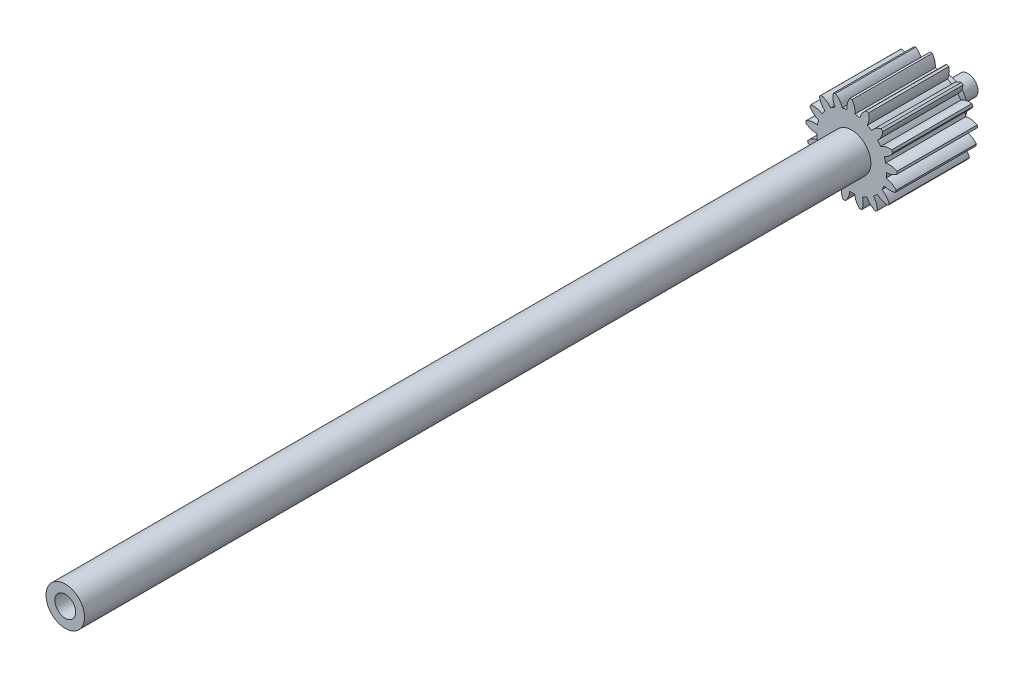
from build123d import *

# Parameters (mm, degrees)
SKETCH1_R           = 2.4
BOSS_EXTRUDE1_DEPTH = 110
SKETCH6_R           = 1.25
BOSS_EXTRUDE2_DEPTH = 2.5
SKETCH7_R           = 1.3
CUT_EXTRUDE1_DEPTH  = 2.5
JOIN1_START         = 2
JOIN1_OUTLINE_R     = 2.4
JOIN1_DEPTH         = 10


# Read off the part's stored shape, not the designer's step: Join1
with BuildPart() as part:
    # Sketch1 → Boss-Extrude1 (new body)
    with BuildSketch(Plane.XY):
        Circle(SKETCH1_R)
    extrude(amount=BOSS_EXTRUDE1_DEPTH)

    # Sketch6 → Boss-Extrude2 (add)
    with BuildSketch(Plane(origin=(0, 0, 0), x_dir=(-1, 0, 0), z_dir=(0, 0, -1))):
        Circle(SKETCH6_R)
    extrude(amount=BOSS_EXTRUDE2_DEPTH)

    # Sketch7 → Cut-Extrude1 (cut)
    with BuildSketch(Plane.XY.offset(110)):
        Circle(SKETCH7_R)
    extrude(amount=-CUT_EXTRUDE1_DEPTH, mode=Mode.SUBTRACT)

    # Join1 outline → Join1 (add)
    with BuildSketch(Plane.XY.offset(JOIN1_START)):
        with BuildLine():
            ThreePointArc((-3.708118179, -2.272368933), (-4.244159788, -2.755671749), (-4.578357083, -3.395386049))
            ThreePointArc((-4.578357083, -3.395386049), (-4.491909089, -3.508953224), (-4.402644734, -3.620320337))
            ThreePointArc((-4.402644734, -3.620320337), (-3.701059107, -3.450910109), (-3.102375311, -3.047797308))
            ThreePointArc((-3.102375311, -3.047797308), (-2.876945397, -3.261439281), (-2.636842886, -3.458447715))
            ThreePointArc((-2.636842886, -3.458447715), (-2.962097686, -4.102754733), (-3.042635922, -4.81999654))
            ThreePointArc((-3.042635922, -4.81999654), (-2.921000374, -4.89466616), (-2.7975334, -4.966266895))
            ThreePointArc((-2.7975334, -4.966266895), (-2.204522319, -4.554854601), (-1.791887445, -3.962693577))
            ThreePointArc((-1.791887445, -3.962693577), (-1.504503928, -4.080474106), (-1.20944735, -4.177443968))
            ThreePointArc((-1.20944735, -4.177443968), (-1.279987877, -4.895737955), (-1.095989921, -5.593639789))
            ThreePointArc((-1.095989921, -5.593639789), (-0.955594371, -5.619327308), (-0.814599678, -5.64149159))
            ThreePointArc((-0.814599678, -5.64149159), (-0.410252576, -5.04364074), (-0.239395251, -4.34240612))
            ThreePointArc((-0.239395251, -4.34240612), (0.071129132, -4.348418292), (0.381290753, -4.332253266))
            ThreePointArc((0.381290753, -4.332253266), (0.574991387, -5.027524639), (0.998675593, -5.61183099))
            ThreePointArc((0.998675593, -5.61183099), (1.138869946, -5.585067166), (1.278350244, -5.554801585))
            ThreePointArc((1.278350244, -5.554801585), (1.439424051, -4.851255249), (1.345428599, -4.135652655))
            ThreePointArc((1.345428599, -4.135652655), (1.63715581, -4.029084493), (1.920533427, -3.901967754))
            ThreePointArc((1.920533427, -3.901967754), (2.352314878, -4.480316262), (2.958464434, -4.872113319))
            ThreePointArc((2.958464434, -4.872113319), (3.079523566, -4.796512755), (3.198651882, -4.717904846))
            ThreePointArc((3.198651882, -4.717904846), (3.094698483, -4.003680856), (2.748544861, -3.370356383))
            ThreePointArc((2.748544861, -3.370356383), (2.982075524, -3.165600507), (3.200397419, -2.944699876))
            ThreePointArc((3.200397419, -2.944699876), (3.81194521, -3.328016348), (4.518696259, -3.474389747))
            ThreePointArc((4.518696259, -3.474389747), (4.604270465, -3.360162718), (4.686957859, -3.243828915))
            ThreePointArc((4.686957859, -3.243828915), (4.332016737, -2.615387177), (3.78045491, -2.149874805))
            ThreePointArc((3.78045491, -2.149874805), (3.924249414, -1.874584632), (4.048030006, -1.589733962))
            ThreePointArc((4.048030006, -1.589733962), (4.756751219, -1.726249384), (5.468653116, -1.607430588))
            ThreePointArc((5.468653116, -1.607430588), (5.507185124, -1.470004087), (5.542264206, -1.331655914))
            ThreePointArc((5.542264206, -1.331655914), (4.984272126, -0.873870968), (4.301793574, -0.639040722))
            ThreePointArc((4.301793574, -0.639040722), (4.336431675, -0.330395714), (4.34895371, -0.020065668))
            ThreePointArc((4.34895371, -0.020065668), (5.059131618, 0.108657124), (5.680038067, 0.47662098))
            ThreePointArc((5.680038067, 0.47662098), (5.666323915, 0.618686743), (5.649057061, 0.760364598))
            ThreePointArc((5.649057061, 0.760364598), (4.963373946, 0.985666358), (4.24215118, 0.958099352))
            ThreePointArc((4.24215118, 0.958099352), (4.16295481, 1.258414976), (4.062527116, 1.552312606))
            ThreePointArc((4.062527116, 1.552312606), (4.678248257, 1.928888885), (5.124302402, 2.496302243))
            ThreePointArc((5.124302402, 2.496302243), (5.060194264, 2.623820499), (4.992913458, 2.749693657))
            ThreePointArc((4.992913458, 2.749693657), (4.272144611, 2.71208398), (3.609582762, 2.425842799))
            ThreePointArc((3.609582762, 2.425842799), (3.42724783, 2.67726975), (3.227433725, 2.915042461))
            ThreePointArc((3.227433725, 2.915042461), (3.665541547, 3.488613515), (3.876501304, 4.178844056))
            ThreePointArc((3.876501304, 4.178844056), (3.770657338, 4.274592757), (3.662449225, 4.367661351))
            ThreePointArc((3.662449225, 4.367661351), (3.003938474, 4.072219633), (2.48952019, 3.565962734))
            ThreePointArc((2.48952019, 3.565962734), (2.228672039, 3.734544409), (1.956457525, 3.884079679))
            ThreePointArc((1.956457525, 3.884079679), (2.15778314, 4.577181558), (2.105157224, 5.297009823))
            ThreePointArc((2.105157224, 5.297009823), (1.971872245, 5.348057577), (1.83735093, 5.395752177))
            ThreePointArc((1.83735093, 5.395752177), (1.3300338, 4.882379459), (1.033234122, 4.224479642))
            ThreePointArc((1.033234122, 4.224479642), (0.72910174, 4.287448152), (0.421250895, 4.328550414))
            ThreePointArc((0.421250895, 4.328550414), (0.358604163, 5.047575869), (0.049499995, 5.699785062))
            ThreePointArc((0.049499995, 5.699785062), (-0.093225122, 5.699237587), (-0.235891789, 5.695116774))
            ThreePointArc((-0.235891789, 5.695116774), (-0.523499308, 5.033146885), (-0.562595939, 4.312457166))
            ThreePointArc((-0.562595939, 4.312457166), (-0.868937788, 4.261308264), (-1.170848002, 4.18842643))
            ThreePointArc((-1.170848002, 4.18842643), (-1.489006294, 4.836267088), (-2.012842482, 5.332772744))
            ThreePointArc((-2.012842482, 5.332772744), (-2.14573192, 5.28070398), (-2.277276015, 5.225324292))
            ThreePointArc((-2.277276015, 5.225324292), (-2.306330934, 4.504159935), (-2.082444302, 3.818013453))
            ThreePointArc((-2.082444302, 3.818013453), (-2.349622454, 3.659655082), (-2.604817389, 3.482632247))
            ThreePointArc((-2.604817389, 3.482632247), (-3.1355182, 3.971793639), (-3.803339428, 4.245539918))
            ThreePointArc((-3.803339428, 4.245539918), (-3.908445731, 4.14898204), (-4.011101496, 4.04982281))
            ThreePointArc((-4.011101496, 4.04982281), (-3.777679787, 3.366861227), (-3.321047022, 2.807925868))
            ThreePointArc((-3.321047022, 2.807925868), (-3.512977588, 2.563745203), (-3.686991754, 2.306489282))
            ThreePointArc((-3.686991754, 2.306489282), (-4.358560998, 2.570907451), (-5.080174309, 2.584923401))
            ThreePointArc((-5.080174309, 2.584923401), (-5.14330229, 2.456917084), (-5.203205494, 2.327370316))
            ThreePointArc((-5.203205494, 2.327370316), (-4.738832052, 1.774849254), (-4.111123939, 1.418612334))
            ThreePointArc((-4.111123939, 1.418612334), (-4.201885632, 1.121587328), (-4.271217452, 0.818842159))
            ThreePointArc((-4.271217452, 0.818842159), (-4.992955982, 0.822805965), (-5.6709035, 0.575198654))
            ThreePointArc((-5.6709035, 0.575198654), (-5.683527374, 0.433031862), (-5.692587758, 0.290593566))
            ThreePointArc((-5.692587758, 0.290593566), (-5.05997879, -0.056865946), (-4.345970788, -0.162292656))
            ThreePointArc((-4.345970788, -0.162292656), (-4.323305738, -0.472047131), (-4.278591565, -0.779394136))
            ThreePointArc((-4.278591565, -0.779394136), (-4.953024594, -1.036420026), (-5.49574575, -1.512209858))
            ThreePointArc((-5.49574575, -1.512209858), (-5.456160592, -1.649336712), (-5.413154501, -1.785429457))
            ThreePointArc((-5.413154501, -1.785429457), (-4.697747354, -1.880901084), (-3.993870201, -1.721279124))
            ThreePointArc((-3.993870201, -1.721279124), (-3.860839448, -2.001929008), (-3.708118179, -2.272368933))
        make_face()
        Circle(JOIN1_OUTLINE_R, mode=Mode.SUBTRACT)
    extrude(amount=JOIN1_DEPTH)


solid = part.part
